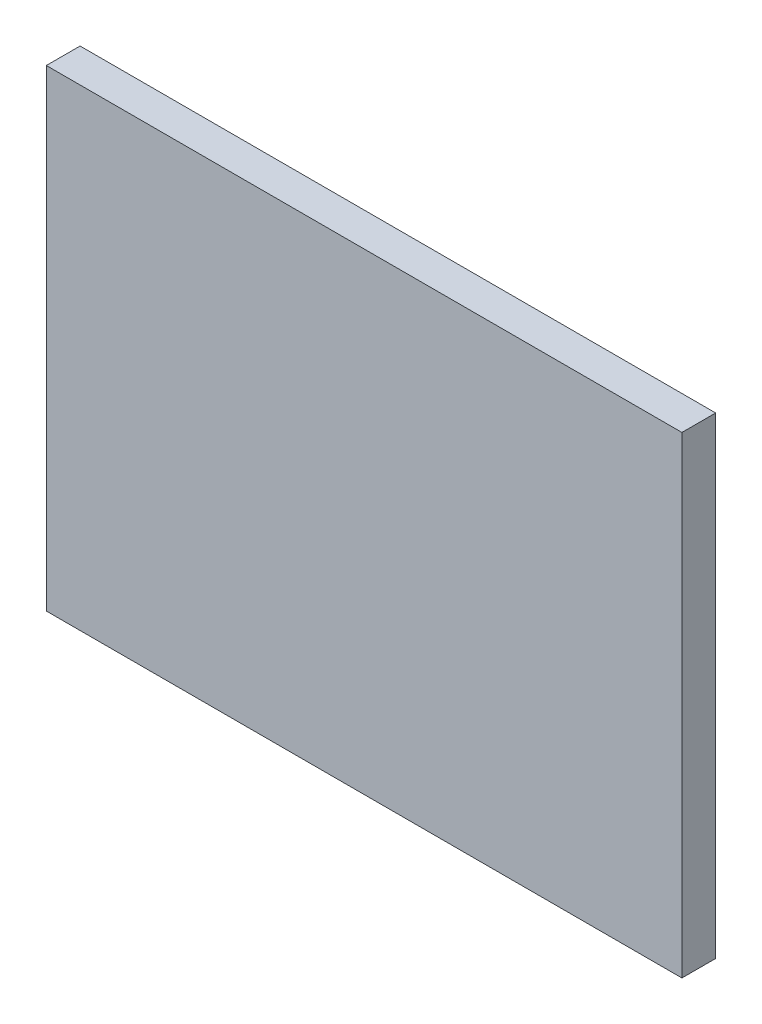
from build123d import *

# Parameters (mm, degrees)
SIDEOUTLINE_W               = 215.265
SIDEOUTLINE_H               = 160.02
SIDEOUTLINE_THICKNESS_DEPTH = 11.43


with BuildPart() as part:
    # SideOutline → SideOutline_Thickness (new body)
    with BuildSketch(Plane.XY):
        with Locations((-4870.7675, 1299.21)):
            Rectangle(SIDEOUTLINE_W, SIDEOUTLINE_H)
    extrude(amount=-SIDEOUTLINE_THICKNESS_DEPTH)


solid = part.part
